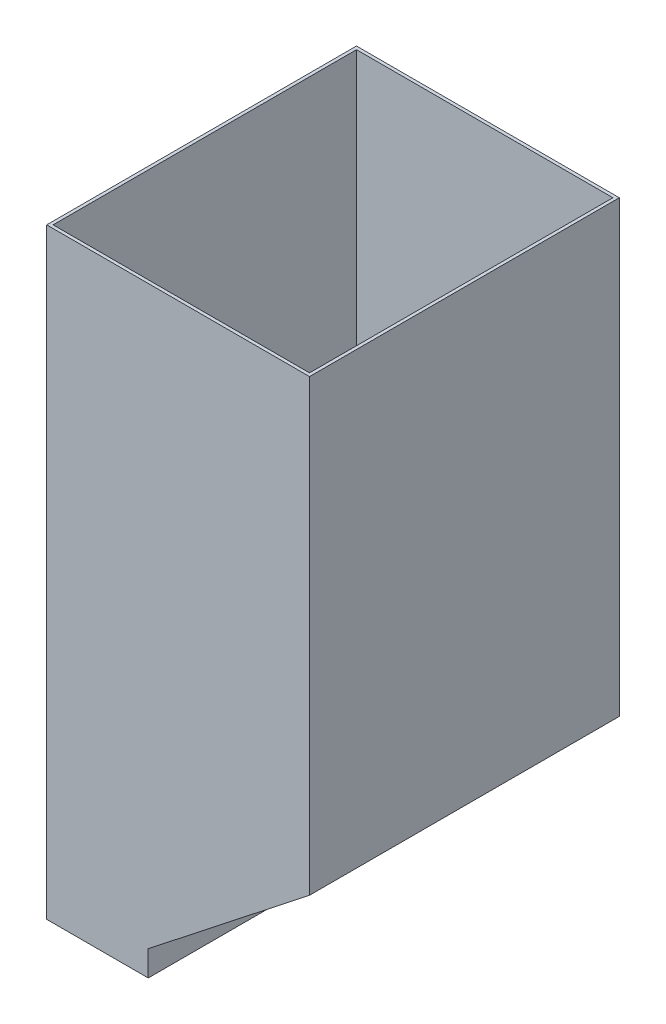
from build123d import *

# Parameters (mm, degrees)
BOSS_EXTRU_1_DEPTH      = 155
ENL_V_MAT_EXTRU_1_DEPTH = 303.65
ESQUISSE4_W             = 6.35
ESQUISSE4_H             = 25.4
BOSS_EXTRU_2_DEPTH      = 95.25


with BuildPart() as part:
    # Esquisse1 → Boss.-Extru.1 (new, symmetric)
    with BuildSketch(Plane.XY):
        Polygon((-29.9, -288.29), (131.5, -161.29), (131.5, 288.29), (-131.5, 288.29), (-131.5, -288.29), (-36.25, -288.29), (-36.25, -313.69), (-29.9, -313.69), align=None)
    extrude(amount=BOSS_EXTRU_1_DEPTH, both=True)

    # Esquisse2 → Enlèv. mat.-Extru.1 (cut)
    with BuildSketch(Plane.XY.offset(151.825)):
        Polygon((-128.325, 288.29), (-128.325, -288.29), (-35.034379222, -288.29), (128.325, -159.748233202), (128.325, 288.29), align=None)
    extrude(amount=-ENL_V_MAT_EXTRU_1_DEPTH, mode=Mode.SUBTRACT)

    # Esquisse4 → Boss.-Extru.2 (add)
    with BuildSketch(Plane.ZY.offset(36.25)):
        with Locations((-151.825, -300.99)):
            Rectangle(ESQUISSE4_W, ESQUISSE4_H)
    boss_extru_2 = extrude(amount=BOSS_EXTRU_2_DEPTH)

    # Symétrie1: Boss.-Extru.2 across plane
    add(boss_extru_2.mirror(Plane.XY))


solid = part.part
